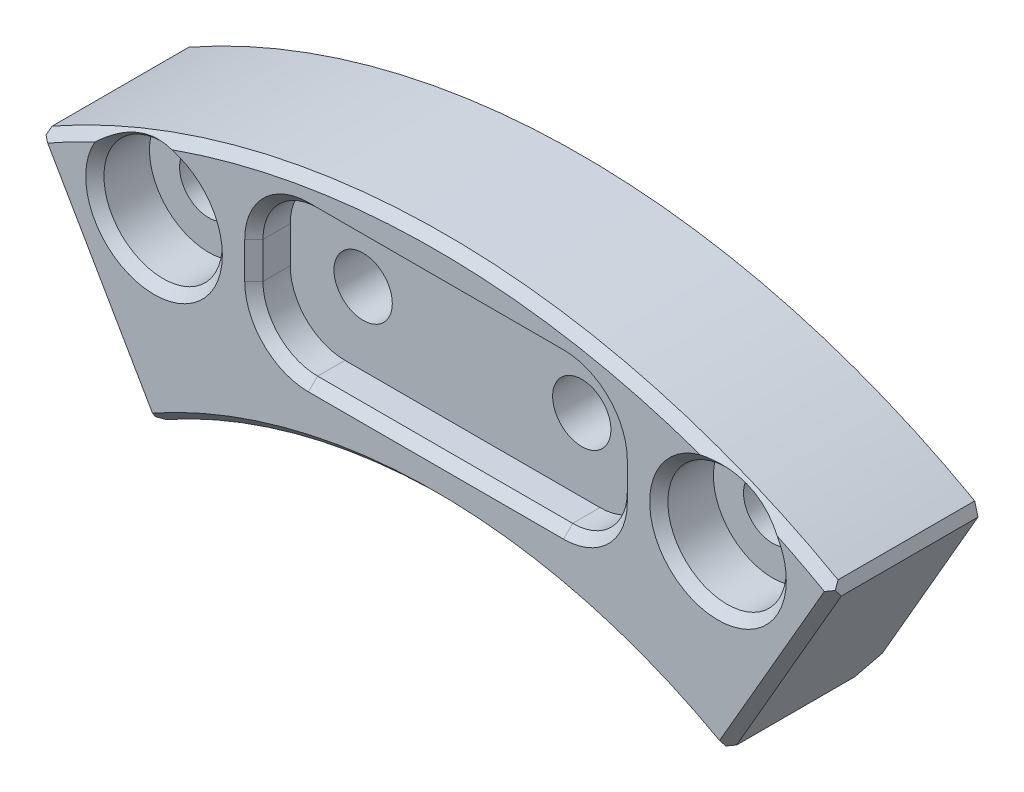
from build123d import *

# Parameters (mm, degrees)
EXTRUDE_1_DEPTH              = 8
CHAMFER_7_SIZE               = 1.5
HOLE_WIZARD_M3_1_D           = 3.2
HOLE_WIZARD_M3_1_CBORE_D     = 6.5
HOLE_WIZARD_M3_1_CBORE_DEPTH = 3
HOLE_WIZARD_M3_2_D           = 3.2
HOLE_WIZARD_M3_2_CBORE_D     = 6.5
HOLE_WIZARD_M3_2_CBORE_DEPTH = 3
CUT_EXTRUDE_6_DEPTH          = 2
CHAMFER_8_SIZE               = 0.5
CHAMFER_9_SIZE               = 0.5


with BuildPart() as part:
    # ｽｹｯﾁ3 → ﾎﾞｽ - 押し出し1 (new body)
    with BuildSketch(Plane.XY.offset(-16.5)):
        with BuildLine():
            Line((58.49999999, 38.105482977), (64.74999999, 27.280165429))
            ThreePointArc((64.74999999, 27.280165429), (80.49999999, 31.50036521), (96.24999999, 27.280165429))
            Line((96.24999999, 27.280165429), (102.49999999, 38.105482977))
            ThreePointArc((102.49999999, 38.105482977), (80.49999999, 44.00036521), (58.49999999, 38.105482977))
        make_face()
    extrude(amount=EXTRUDE_1_DEPTH)

    # 面取り7
    chamfer_7_edges = [part.edges().sort_by_distance(p)[0] for p in [
        (80.49999999, 31.50036521, -16.5),
    ]]
    chamfer(chamfer_7_edges, length=CHAMFER_7_SIZE)

    # M3 穴付きねじ用座ぐり穴1 (through all)
    with Locations(Plane.XY.offset(-8.5)):
        with Locations((65.0229264, 37.390950693), (95.977073581, 37.390950693)):
            CounterBoreHole(HOLE_WIZARD_M3_1_D / 2, HOLE_WIZARD_M3_1_CBORE_D / 2, HOLE_WIZARD_M3_1_CBORE_DEPTH)

    # M3 穴付きねじ用座ぐり穴2 (through all)
    with Locations(Plane(origin=(0, 0, -16.5), x_dir=(-1, 0, 0), z_dir=(0, 0, -1))):
        with Locations((-86.49999999, 37.75036521), (-74.49999999, 37.75036521)):
            CounterBoreHole(HOLE_WIZARD_M3_2_D / 2, HOLE_WIZARD_M3_2_CBORE_D / 2, HOLE_WIZARD_M3_2_CBORE_DEPTH)

    # ｽｹｯﾁ17 → ｶｯﾄ - 押し出し6 (cut)
    with BuildSketch(Plane.XY.offset(-8.5)):
        with BuildLine():
            Line((73.49999999, 41.75036521), (87.49999999, 41.75036521))
            ThreePointArc((87.49999999, 41.75036521), (89.621320334, 40.871685554), (90.49999999, 38.75036521))
            Line((90.49999999, 38.75036521), (90.49999999, 36.75036521))
            ThreePointArc((90.49999999, 36.75036521), (89.621320334, 34.629044867), (87.49999999, 33.75036521))
            Line((87.49999999, 33.75036521), (73.49999999, 33.75036521))
            ThreePointArc((73.49999999, 33.75036521), (71.378679647, 34.629044867), (70.49999999, 36.75036521))
            Line((70.49999999, 36.75036521), (70.49999999, 38.75036521))
            ThreePointArc((70.49999999, 38.75036521), (71.378679647, 40.871685554), (73.49999999, 41.75036521))
        make_face()
    extrude(amount=-CUT_EXTRUDE_6_DEPTH, mode=Mode.SUBTRACT)

    # 面取り8
    # the kernel refuses this chamfer: 0.5 mm, written as the material it takes off along each edge
    with BuildSketch(Plane(origin=(80.49999999, 0.00036521, -8.5), x_dir=(-0.5349312949950591, 0.844895561377209, 0), z_dir=(-0.844895561377209, -0.5349312949950591, 0))) as chamfer_8_piece_1:
        Polygon((31.5, CHAMFER_8_SIZE), (31.5 + CHAMFER_8_SIZE, 0), (31.5, 0), align=None)
    revolve(axis=Axis((80.49999999, 0.00036521, -8.5), (0, 0, -1)), revolution_arc=64.678504259, mode=Mode.SUBTRACT)
    with BuildSketch(Plane(origin=(95.607079243, 26.16659403, -8.5), x_dir=(-0.8660254037844379, 0.5000000000000012, 0), z_dir=(0.5000000000000012, 0.866025403784438, 0))) as chamfer_8_piece_2:
        Polygon((CHAMFER_8_SIZE, 0), (0, -CHAMFER_8_SIZE), (0, 0), align=None)
    extrude(amount=15.071682988, mode=Mode.SUBTRACT)
    with BuildSketch(Plane(origin=(80.49999999, 0.00036521, -8.5), x_dir=(0.5250957878127545, 0.8510431326444641, 0), z_dir=(0.8510431326444641, -0.5250957878127545, 0))) as chamfer_8_piece_3:
        Polygon((44 - CHAMFER_8_SIZE, 0), (44, -CHAMFER_8_SIZE), (44, 0), align=None)
    revolve(axis=Axis((80.49999999, 0.00036521, -8.5), (0, 0, 1)), revolution_arc=63.349383731, mode=Mode.SUBTRACT)
    with BuildSketch(Plane(origin=(95.977073581, 37.390950693, -8.5), x_dir=(1, 0, 0), z_dir=(0, -1, 0))) as chamfer_8_piece_4:
        Polygon((3.25 + CHAMFER_8_SIZE, 0), (3.25, -CHAMFER_8_SIZE), (3.25, 0), align=None)
    revolve(axis=Axis((95.977073581, 37.390950693, -8.5), (0, 0, 1)), mode=Mode.SUBTRACT)
    with BuildSketch(Plane(origin=(65.0229264, 37.390950693, -8.5), x_dir=(1, 0, 0), z_dir=(0, -1, 0))) as chamfer_8_piece_5:
        Polygon((3.25 + CHAMFER_8_SIZE, 0), (3.25, -CHAMFER_8_SIZE), (3.25, 0), align=None)
    revolve(axis=Axis((65.0229264, 37.390950693, -8.5), (0, 0, 1)), mode=Mode.SUBTRACT)
    with BuildSketch(Plane(origin=(57.857079243, 39.219054376, -8.5), x_dir=(0, 0, -1), z_dir=(0.5000000000000007, -0.8660254037844384, 0))) as chamfer_8_piece_6:
        Polygon((CHAMFER_8_SIZE, 0), (0, CHAMFER_8_SIZE), (0, 0), align=None)
    extrude(amount=15.071682988, mode=Mode.SUBTRACT)
    with BuildSketch(Plane(origin=(87.49999999, 38.75036521, -8.5), x_dir=(0, 1, 0), z_dir=(-1, 0, 0))) as chamfer_8_piece_7:
        Polygon((3 + CHAMFER_8_SIZE, 0), (3, CHAMFER_8_SIZE), (3, 0), align=None)
    revolve(axis=Axis((87.49999999, 38.75036521, -8.5), (0, 0, -1)), revolution_arc=90, mode=Mode.SUBTRACT)
    with BuildSketch(Plane(origin=(73.49999999, 41.75036521, -8.5), x_dir=(0, 1, 0), z_dir=(1, 0, 0)), Plane(origin=(87.49999999, 33.75036521, -8.5), x_dir=(0, -1, 0), z_dir=(-1, 0, 0))) as chamfer_8_piece_8:
        Polygon((CHAMFER_8_SIZE, 0), (0, -CHAMFER_8_SIZE), (0, 0), align=None)
    extrude(amount=14, mode=Mode.SUBTRACT)
    with BuildSketch(Plane(origin=(73.49999999, 38.75036521, -8.5), x_dir=(-1, 0, 0), z_dir=(0, -1, 0))) as chamfer_8_piece_9:
        Polygon((3 + CHAMFER_8_SIZE, 0), (3, CHAMFER_8_SIZE), (3, 0), align=None)
    revolve(axis=Axis((73.49999999, 38.75036521, -8.5), (0, 0, -1)), revolution_arc=90, mode=Mode.SUBTRACT)
    with BuildSketch(Plane(origin=(70.49999999, 36.75036521, -8.5), x_dir=(-1, 0, 0), z_dir=(0, 1, 0)), Plane(origin=(90.49999999, 38.75036521, -8.5), x_dir=(1, 0, 0), z_dir=(0, -1, 0))) as chamfer_8_piece_10:
        Polygon((CHAMFER_8_SIZE, 0), (0, -CHAMFER_8_SIZE), (0, 0), align=None)
    extrude(amount=2, mode=Mode.SUBTRACT)
    with BuildSketch(Plane(origin=(73.49999999, 36.75036521, -8.5), x_dir=(0, -1, 0), z_dir=(1, 0, 0))) as chamfer_8_piece_11:
        Polygon((3 + CHAMFER_8_SIZE, 0), (3, CHAMFER_8_SIZE), (3, 0), align=None)
    revolve(axis=Axis((73.49999999, 36.75036521, -8.5), (0, 0, -1)), revolution_arc=90, mode=Mode.SUBTRACT)
    with BuildSketch(Plane(origin=(87.49999999, 36.75036521, -8.5), x_dir=(1, 0, 0), z_dir=(0, 1, 0))) as chamfer_8_piece_12:
        Polygon((3 + CHAMFER_8_SIZE, 0), (3, CHAMFER_8_SIZE), (3, 0), align=None)
    revolve(axis=Axis((87.49999999, 36.75036521, -8.5), (0, 0, -1)), revolution_arc=90, mode=Mode.SUBTRACT)

    # 面取り9
    # the kernel refuses this chamfer: 0.5 mm, written as the material it takes off along each edge
    with BuildSketch(Plane(origin=(96.24999999, 27.280165429, -16.296233904), x_dir=(-0.8699980733677616, 0.4930551209919465, 0), z_dir=(0, 0, 1))) as chamfer_9_piece_1:
        with BuildLine():
            Line((0.504048916, 0), (-CHAMFER_9_SIZE * 0.00800077643885, -CHAMFER_9_SIZE * 0.999967993276))
            Line((-CHAMFER_9_SIZE * 0.00800077643885, -CHAMFER_9_SIZE * 0.999967993276), (0, 0))
            ThreePointArc((0, 0), (0.259153689, -0.001007405), (0.504048916, 0))
        make_face()
    extrude(amount=8.592467809, mode=Mode.SUBTRACT)
    with BuildSketch(Plane(origin=(64.74999999, 27.280165429, -16.296233904), x_dir=(-0.499999999999999, 0.8660254037844393, 0), z_dir=(0, 0, 1))) as chamfer_9_piece_2:
        with BuildLine():
            Line((CHAMFER_9_SIZE, 0), (-0.004032783, -0.504032783))
            ThreePointArc((-0.004032783, -0.504032783), (-0.001066058, -0.259153454), (0, 0))
            Line((0, 0), (CHAMFER_9_SIZE, 0))
        make_face()
    extrude(amount=8.592467809, mode=Mode.SUBTRACT)
    with BuildSketch(Plane(origin=(58.49999999, 38.105482977, -17.785841494), x_dir=(0.5000000000000021, -0.8660254037844375, 0), z_dir=(0, 0, 1))) as chamfer_9_piece_3:
        with BuildLine():
            Line((CHAMFER_9_SIZE, 0), (0.002809166, 0.497190834))
            ThreePointArc((0.002809166, 0.497190834), (0.000742578, 0.255629249), (0, 0))
            Line((0, 0), (CHAMFER_9_SIZE, 0))
        make_face()
    extrude(amount=10.071682988, mode=Mode.SUBTRACT)
    with BuildSketch(Plane(origin=(102.49999999, 38.105482977, -17.785841494), x_dir=(-0.8688365739050292, 0.4950989879256175, 0), z_dir=(0, 0, 1))) as chamfer_9_piece_4:
        with BuildLine():
            Line((0.49719877, 0), (CHAMFER_9_SIZE * 0.00564998602096, CHAMFER_9_SIZE * 0.999984038702))
            Line((CHAMFER_9_SIZE * 0.00564998602096, CHAMFER_9_SIZE * 0.999984038702), (0, 0))
            ThreePointArc((0, 0), (0.255629364, -0.000701736), (0.49719877, 0))
        make_face()
    extrude(amount=10.071682988, mode=Mode.SUBTRACT)


solid = part.part
